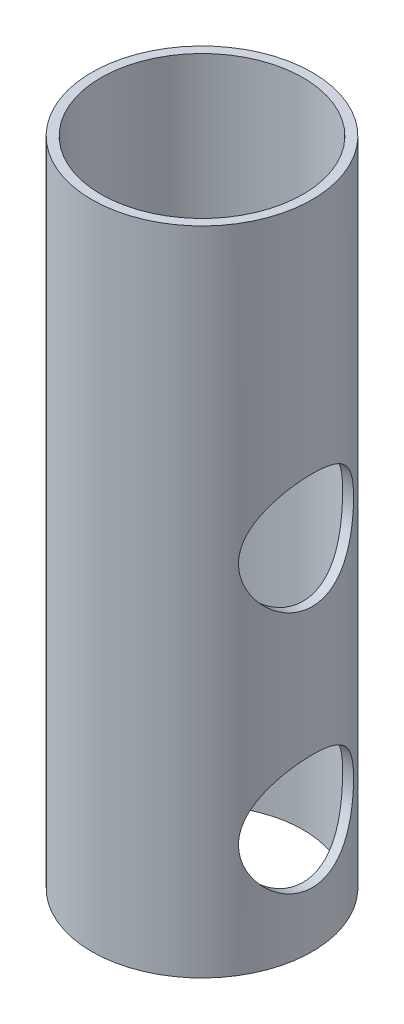
from build123d import *

# Parameters (mm, degrees)
SKETCH1_R           = 24
SKETCH1_R_2         = 22
BOSS_EXTRUDE1_DEPTH = 141.8
SKETCH2_R           = 12.53
CUT_EXTRUDE1_DEPTH  = 146.805486865


with BuildPart() as part:
    # Sketch1 → Boss-Extrude1 (new body)
    with BuildSketch(Plane(origin=(0, 0, 0), x_dir=(1, 0, 0), z_dir=(0, 1, 0))):
        Circle(SKETCH1_R)
        Circle(SKETCH1_R_2, mode=Mode.SUBTRACT)
    extrude(amount=BOSS_EXTRUDE1_DEPTH)

    # Sketch2 → Cut-Extrude1 (cut, through all)
    with BuildSketch(Plane(origin=(0, 0, 0), x_dir=(0, 0, -1), z_dir=(1, 0, 0))):
        with Locations((0, 24.6)):
            Circle(SKETCH2_R)
        with Locations((0, 77.6)):
            Circle(SKETCH2_R)
    extrude(amount=CUT_EXTRUDE1_DEPTH, mode=Mode.SUBTRACT)


solid = part.part
